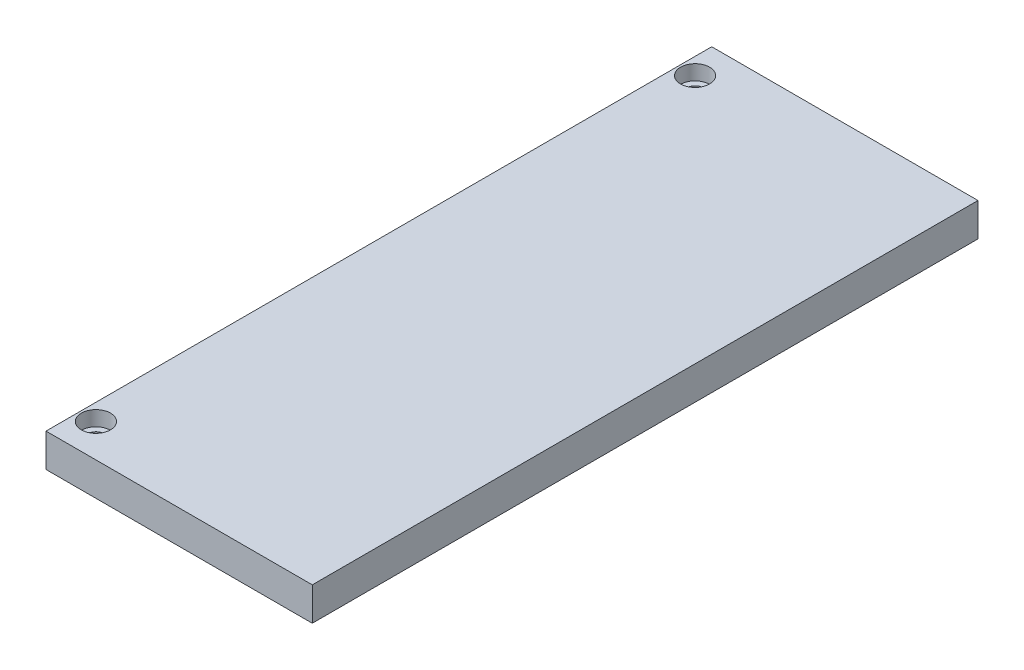
from build123d import *

# Parameters (mm, degrees)
SKETCH1_W                                      = 50.8
SKETCH1_H                                      = 127
BOSS_EXTRUDE1_DEPTH                            = 6.35
CBORE_FOR_4_SOCKET_HEAD_CAP_SCREW1_D           = 3.2639
CBORE_FOR_4_SOCKET_HEAD_CAP_SCREW1_CBORE_D     = 5.55752
CBORE_FOR_4_SOCKET_HEAD_CAP_SCREW1_CBORE_DEPTH = 2.8448


with BuildPart() as part:
    # Sketch1 → Boss-Extrude1 (new body)
    with BuildSketch(Plane(origin=(0, 0, 0), x_dir=(1, 0, 0), z_dir=(0, 1, 0))):
        Rectangle(SKETCH1_W, SKETCH1_H)
    extrude(amount=BOSS_EXTRUDE1_DEPTH)

    # CBORE for #4 Socket Head Cap Screw1 (through all)
    with Locations(Plane(origin=(0, 6.35, 0), x_dir=(1, 0, 0), z_dir=(0, 1, 0))):
        with Locations((-22.225, -57.15), (-22.225, 57.15)):
            CounterBoreHole(CBORE_FOR_4_SOCKET_HEAD_CAP_SCREW1_D / 2, CBORE_FOR_4_SOCKET_HEAD_CAP_SCREW1_CBORE_D / 2, CBORE_FOR_4_SOCKET_HEAD_CAP_SCREW1_CBORE_DEPTH)


solid = part.part
